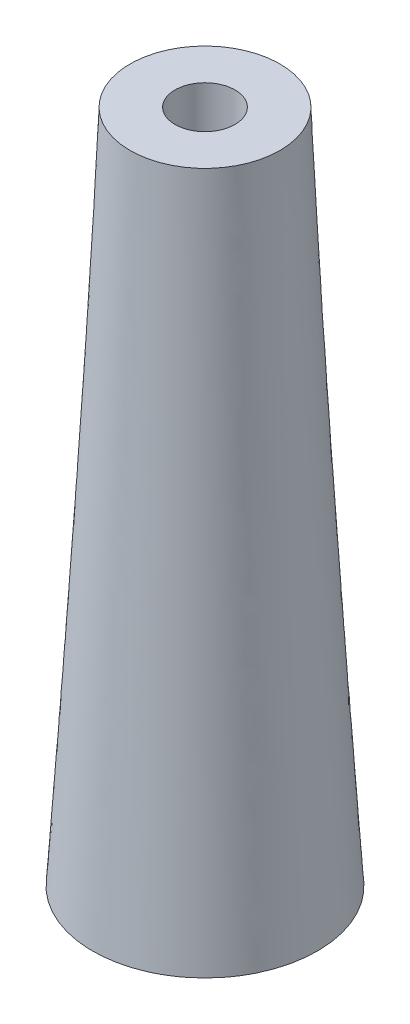
from build123d import *

# Parameters (mm, degrees)
CORTAR_EXTRUIR1_DEPTH      = 40
CORTAR_EXTRUIR1_DEPTH_BACK = 529
CROQUIS4_R                 = 20


with BuildPart() as part:
    # Recubrir2: read off the stored shape, not the designer's step
    # Recubrir2: loft between two sections, ruled curve by curve
    recubrir2_from = [
        Edge.make_bspline([(16.90733403, 450, 47.054670927), (-77.202007823, 450, 80.869338986), (-111.016675883, 450, -13.240002867), (-16.90733403, 450, -47.054670927), (77.202007823, 450, -80.869338986), (111.016675883, 450, 13.240002867), (16.90733403, 450, 47.054670927)], [0, 0, 0, 0, 0.5, 0.5, 0.5, 1, 1, 1, 1], 3, [1, 0.333333333, 0.333333333, 1, 0.333333333, 0.333333333, 1]),
    ]
    recubrir2_to = [
        Edge.make_bspline([(52.631645486, 0, 53.431356837), (-54.231068189, 0, 158.694647809), (-159.49435916, 0, 51.831934134), (-52.631645486, 0, -53.431356837), (54.231068189, 0, -158.694647809), (159.49435916, 0, -51.831934134), (52.631645486, 0, 53.431356837)], [0, 0, 0, 0, 0.5, 0.5, 0.5, 1, 1, 1, 1], 3, [1, 0.333333333, 0.333333333, 1, 0.333333333, 0.333333333, 1]),
    ]
    recubrir2 = Solid(Shell([*[Face.make_surface_from_curves(recubrir2_from[k], recubrir2_to[k]) for k in range(1)], Face(Wire(recubrir2_from)), Face(Wire(recubrir2_to))]))
    add(recubrir2)

    # Croquis4 → Cortar-Extruir1 (cut, two sides: drawn at the far end of the back side and taken through both)
    with BuildSketch(Plane(origin=(0, 450, 0), x_dir=(1, 0, 0), z_dir=(0, 1, 0)).offset(-CORTAR_EXTRUIR1_DEPTH_BACK)):
        with Locations(Location((0, 0, 0), (0, 0, 270))):
            Circle(CROQUIS4_R)
    extrude(amount=CORTAR_EXTRUIR1_DEPTH + CORTAR_EXTRUIR1_DEPTH_BACK, mode=Mode.SUBTRACT)


solid = part.part
